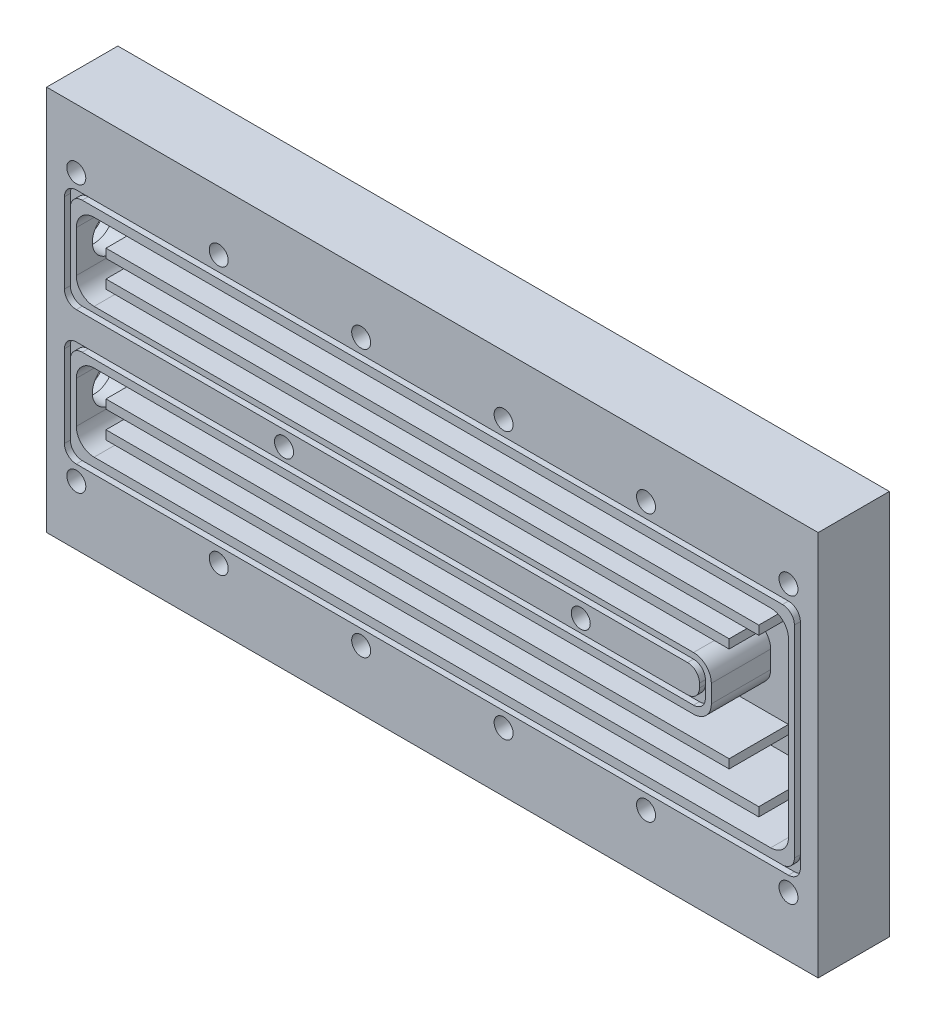
from build123d import *

# Parameters (mm, degrees)
ESQUISSE1_W             = 130
ESQUISSE1_H             = 65
BOSS_EXTRU_1_DEPTH      = 12
ESQUISSE2_R             = 1.6
ENL_V_MAT_EXTRU_1_DEPTH = 146.838952273
ENL_V_MAT_EXTRU_6_DEPTH = 10
D_GAGEMENT_M61_D        = 6.6
D_GAGEMENT_M61_DEPTH    = 6.017159957
D_GAGEMENT_M61_TIP      = 1.982840043
ESQUISSE10_R            = 4
ENL_V_MAT_EXTRU_7_DEPTH = 2
ENL_V_MAT_EXTRU_9_DEPTH = 1
ESQUISSE12_W            = 105
ESQUISSE12_H            = 1.5
ESQUISSE12_W_2          = 110
BOSS_EXTRU_2_DEPTH      = 10


with BuildPart() as part:
    # Esquisse1 → Boss.-Extru.1 (new body)
    with BuildSketch(Plane.XY):
        with Locations((65, 32.5)):
            Rectangle(ESQUISSE1_W, ESQUISSE1_H)
    extrude(amount=BOSS_EXTRU_1_DEPTH)

    # Esquisse2 → Enlèv. mat.-Extru.1 (cut, through all)
    with BuildSketch(Plane.XY.offset(12)):
        with Locations((5, 55)):
            Circle(ESQUISSE2_R)
        with Locations((29, 55)):
            Circle(ESQUISSE2_R)
        with Locations((53, 55)):
            Circle(ESQUISSE2_R)
        with Locations((77, 55)):
            Circle(ESQUISSE2_R)
        with Locations((101, 55)):
            Circle(ESQUISSE2_R)
        with Locations((125, 55)):
            Circle(ESQUISSE2_R)
        with Locations((5, 10)):
            Circle(ESQUISSE2_R)
        with Locations((29, 10)):
            Circle(ESQUISSE2_R)
        with Locations((53, 10)):
            Circle(ESQUISSE2_R)
        with Locations((77, 10)):
            Circle(ESQUISSE2_R)
        with Locations((101, 10)):
            Circle(ESQUISSE2_R)
        with Locations((125, 10)):
            Circle(ESQUISSE2_R)
        with Locations((90, 32.5)):
            Circle(ESQUISSE2_R)
        with Locations((40, 32.5)):
            Circle(ESQUISSE2_R)
    extrude(amount=-ENL_V_MAT_EXTRU_1_DEPTH, mode=Mode.SUBTRACT)

    # Esquisse6 → Enlèv. mat.-Extru.6 (cut)
    with BuildSketch(Plane.XY.offset(12)):
        with BuildLine():
            Line((8, 50), (122, 50))
            ThreePointArc((122, 50), (124.121320344, 49.121320344), (125, 47))
            Line((125, 47), (125, 18))
            ThreePointArc((125, 18), (124.121320344, 15.878679656), (122, 15))
            Line((122, 15), (8, 15))
            ThreePointArc((8, 15), (5.878679656, 15.878679656), (5, 18))
            Line((5, 18), (5, 25))
            ThreePointArc((5, 25), (5.878679656, 27.121320344), (8, 28))
            Line((8, 28), (109, 28))
            ThreePointArc((109, 28), (111.121320344, 28.878679656), (112, 31))
            Line((112, 31), (112, 34))
            ThreePointArc((112, 34), (111.121320344, 36.121320344), (109, 37))
            Line((109, 37), (8, 37))
            ThreePointArc((8, 37), (5.878679656, 37.878679656), (5, 40))
            Line((5, 40), (5, 47))
            ThreePointArc((5, 47), (5.878679656, 49.121320344), (8, 50))
        make_face()
    extrude(amount=-ENL_V_MAT_EXTRU_6_DEPTH, mode=Mode.SUBTRACT)

    # Dégagement M61
    with Locations(Plane.ZY):
        with Locations((6, 43.5), (6, 21.5)):
            Hole(D_GAGEMENT_M61_D / 2, depth=D_GAGEMENT_M61_DEPTH)
            with Locations((0, 0, -(D_GAGEMENT_M61_DEPTH + D_GAGEMENT_M61_TIP / 2))):  # 118° drill point
                Cone(0, D_GAGEMENT_M61_D / 2, D_GAGEMENT_M61_TIP, mode=Mode.SUBTRACT)

    # Esquisse10 → Enlèv. mat.-Extru.7 (cut)
    with BuildSketch(Plane.ZY):
        with Locations((6, 21.5)):
            Circle(ESQUISSE10_R)
        with Locations((6, 43.5)):
            Circle(ESQUISSE10_R)
    extrude(amount=-ENL_V_MAT_EXTRU_7_DEPTH, mode=Mode.SUBTRACT)

    # Esquisse11 → Enlèv. mat.-Extru.9 (cut)
    with BuildSketch(Plane.XY.offset(12)):
        with BuildLine():
            Line((125, 12.5), (5, 12.5))
            ThreePointArc((5, 12.5), (3.585786438, 13.085786438), (3, 14.5))
            Line((3, 14.5), (3, 28.315802411))
            ThreePointArc((3, 28.315802411), (3.585786438, 29.730015973), (5, 30.315802411))
            Line((5, 30.315802411), (108, 30.315802411))
            ThreePointArc((108, 30.315802411), (109.414213562, 30.901588849), (110, 32.315802411))
            Line((110, 32.315802411), (110, 33.034217912))
            ThreePointArc((110, 33.034217912), (109.414213562, 34.448431474), (108, 35.034217912))
            Line((108, 35.034217912), (5, 35.034217912))
            ThreePointArc((5, 35.034217912), (3.585786438, 35.620004349), (3, 37.034217912))
            Line((3, 37.034217912), (3, 50.5))
            ThreePointArc((3, 50.5), (3.585786438, 51.914213562), (5, 52.5))
            Line((5, 52.5), (125, 52.5))
            ThreePointArc((125, 52.5), (126.414213562, 51.914213562), (127, 50.5))
            Line((127, 50.5), (127, 14.5))
            ThreePointArc((127, 14.5), (126.414213562, 13.085786438), (125, 12.5))
        make_face()
        with BuildLine():
            Line((6, 51.5), (124, 51.5))
            ThreePointArc((124, 51.5), (125.414213562, 50.914213562), (126, 49.5))
            Line((126, 49.5), (126, 15.5))
            ThreePointArc((126, 15.5), (125.414213562, 14.085786438), (124, 13.5))
            Line((124, 13.5), (6, 13.5))
            ThreePointArc((6, 13.5), (4.585786438, 14.085786438), (4, 15.5))
            Line((4, 15.5), (4, 27.315802411))
            ThreePointArc((4, 27.315802411), (4.585786438, 28.730015973), (6, 29.315802411))
            Line((6, 29.315802411), (109, 29.315802411))
            ThreePointArc((109, 29.315802411), (110.414213562, 29.901588849), (111, 31.315802411))
            Line((111, 31.315802411), (111, 34.034217912))
            ThreePointArc((111, 34.034217912), (110.414213562, 35.448431474), (109, 36.034217912))
            Line((109, 36.034217912), (6, 36.034217912))
            ThreePointArc((6, 36.034217912), (4.585786438, 36.620004349), (4, 38.034217912))
            Line((4, 38.034217912), (4, 49.5))
            ThreePointArc((4, 49.5), (4.585786438, 50.914213562), (6, 51.5))
        make_face(mode=Mode.SUBTRACT)
    extrude(amount=-ENL_V_MAT_EXTRU_9_DEPTH, mode=Mode.SUBTRACT)

    # Esquisse12 → Boss.-Extru.2 (add)
    with BuildSketch(Plane.XY.offset(2)):
        with Locations((62.5, 41.25)):
            Rectangle(ESQUISSE12_W, ESQUISSE12_H)
        with Locations((65, 45.75)):
            Rectangle(ESQUISSE12_W_2, ESQUISSE12_H)
        with Locations((65, 19.25)):
            Rectangle(ESQUISSE12_W_2, ESQUISSE12_H)
        with Locations((62.5, 23.75)):
            Rectangle(ESQUISSE12_W, ESQUISSE12_H)
    extrude(amount=BOSS_EXTRU_2_DEPTH)


solid = part.part
